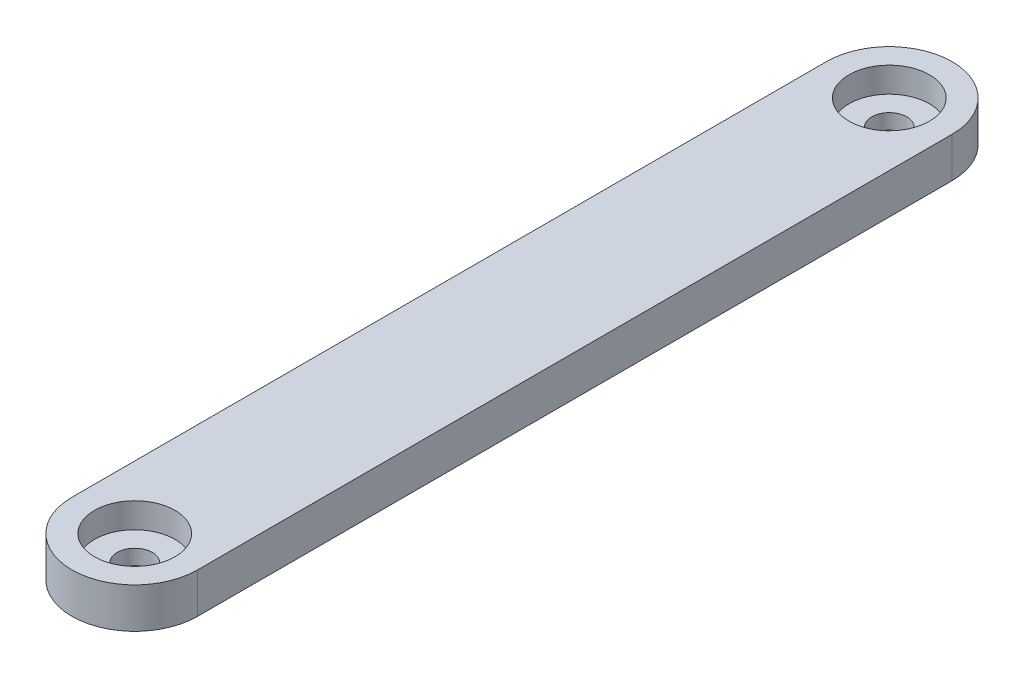
from build123d import *

# Parameters (mm, degrees)
BOSS_EXTRUDE1_DEPTH = 8
SKETCH2_R           = 8
CUT_EXTRUDE1_DEPTH  = 5
SKETCH3_R           = 3.5
CUT_EXTRUDE2_DEPTH  = 164.176285042
SKETCH4_R           = 8
CUT_EXTRUDE3_DEPTH  = 5
SKETCH5_R           = 3.5
CUT_EXTRUDE4_DEPTH  = 164.176285042


with BuildPart() as part:
    # Sketch1 → Boss-Extrude1 (new body)
    with BuildSketch(Plane(origin=(0, 0, 0), x_dir=(1, 0, 0), z_dir=(0, 1, 0))):
        with BuildLine():
            Line((-12.5, 0), (-12.5, -150))
            ThreePointArc((-12.5, -150), (0, -162.5), (12.5, -150))
            Line((12.5, -150), (12.5, 0))
            ThreePointArc((12.5, 0), (0, 12.5), (-12.5, 0))
        make_face()
    extrude(amount=BOSS_EXTRUDE1_DEPTH)

    # Sketch2 → Cut-Extrude1 (cut)
    with BuildSketch(Plane(origin=(0, 8, 0), x_dir=(1, 0, 0), z_dir=(0, 1, 0))):
        Circle(SKETCH2_R)
    extrude(amount=-CUT_EXTRUDE1_DEPTH, mode=Mode.SUBTRACT)

    # Sketch3 → Cut-Extrude2 (cut, through all)
    with BuildSketch(Plane(origin=(0, 8, 0), x_dir=(1, 0, 0), z_dir=(0, 1, 0))):
        Circle(SKETCH3_R)
    extrude(amount=-CUT_EXTRUDE2_DEPTH, mode=Mode.SUBTRACT)

    # Sketch4 → Cut-Extrude3 (cut)
    with BuildSketch(Plane(origin=(0, 8, 0), x_dir=(1, 0, 0), z_dir=(0, 1, 0))):
        with Locations((0, -150)):
            Circle(SKETCH4_R)
    extrude(amount=-CUT_EXTRUDE3_DEPTH, mode=Mode.SUBTRACT)

    # Sketch5 → Cut-Extrude4 (cut, through all)
    with BuildSketch(Plane(origin=(0, 8, 0), x_dir=(1, 0, 0), z_dir=(0, 1, 0))):
        with Locations((0, -150)):
            Circle(SKETCH5_R)
    extrude(amount=-CUT_EXTRUDE4_DEPTH, mode=Mode.SUBTRACT)


solid = part.part
